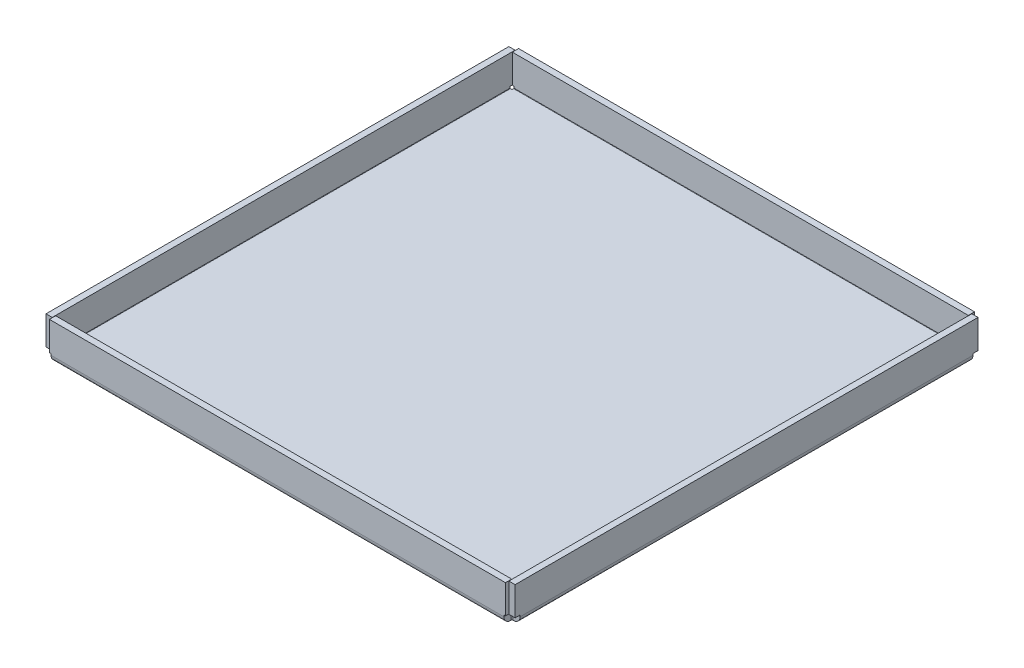
from build123d import *

# Parameters (mm, degrees)
SKETCH1_W                    = 736.6
SKETCH1_H                    = 736.6
BOSS_EXTRUDE1_DEPTH          = 50.8
SHELL1_T                     = -1.5875
CONVERT_SOLID1_START         = -368.3
CONVERT_SOLID1_DEPTH         = 4.587500016
CONVERT_SOLID1_START_2       = 363.712499984
CONVERT_SOLID1_2_DEPTH       = 4.587500016
CONVERT_SOLID1_START_3       = -363.712499984
CONVERT_SOLID1_3_DEPTH       = 727.424999968
CONVERT_SOLID1_START_4       = -376.7125
CONVERT_SOLID1_4_DEPTH       = 10.500000016
CONVERT_SOLID1_START_5       = 366.212499984
CONVERT_SOLID1_5_DEPTH       = 10.500000016
CONVERT_SOLID1_START_6       = -371.7125
CONVERT_SOLID1_6_OUTLINE_W   = 727.424999968
CONVERT_SOLID1_6_OUTLINE_H   = 8.4125
CONVERT_SOLID1_6_OUTLINE_W_2 = 10
CONVERT_SOLID1_6_OUTLINE_H_2 = 46.212499984
CONVERT_SOLID1_6_DEPTH       = 743.425
CONVERT_SOLID1_START_7       = -366.2125
CONVERT_SOLID1_7_DEPTH       = 732.425
CONVERT_SOLID1_START_8       = -366.7125
CONVERT_SOLID1_8_OUTLINE_W   = 49.2125
CONVERT_SOLID1_8_OUTLINE_H   = 1.5875
CONVERT_SOLID1_8_DEPTH       = 0.5
CONVERT_SOLID1_START_9       = 366.2125
CONVERT_SOLID1_9_OUTLINE_W   = 49.2125
CONVERT_SOLID1_9_OUTLINE_H   = 1.5875
CONVERT_SOLID1_9_DEPTH       = 0.5
CONVERT_SOLID1_10_OUTLINE_W  = 3.000000016
CONVERT_SOLID1_10_OUTLINE_H  = 1.5875
CONVERT_SOLID1_10_DEPTH      = 2.500000016
CONVERT_SOLID1_11_OUTLINE_W  = 3.000000016
CONVERT_SOLID1_11_OUTLINE_H  = 1.5875
CONVERT_SOLID1_11_DEPTH      = 2.500000016


with BuildPart() as part:
    # Sketch1 → Boss-Extrude1 (new body)
    with BuildSketch(Plane(origin=(0, 0, 0), x_dir=(1, 0, 0), z_dir=(0, 1, 0))):
        Rectangle(SKETCH1_W, SKETCH1_H)
    extrude(amount=BOSS_EXTRUDE1_DEPTH)

    # Shell1
    shell1_openings = [part.faces().sort_by_distance(p)[0] for p in [
        (0, 50.8, 0),
    ]]
    offset(amount=SHELL1_T, openings=shell1_openings, kind=Kind.INTERSECTION)

    # Convert-Solid1: read off the stored shape, not the designer's step
    # Convert-Solid1 outline → Convert-Solid1 (cut)
    with BuildSketch(Plane.XY.offset(CONVERT_SOLID1_START)):
        with BuildLine():
            Line((366.212499984, 1.5875), (363.712499984, 1.5875))
            Line((363.712499984, 1.5875), (363.712499984, 0))
            Line((363.712499984, 0), (368.3, 0))
            Line((368.3, 0), (368.3, 4.587500016))
            Line((368.3, 4.587500016), (366.7125, 4.587500016))
            Line((366.7125, 4.587500016), (366.7125, 2.087500016))
            ThreePointArc((366.7125, 2.087500016), (366.566053386, 1.733946614), (366.212499984, 1.5875))
        make_face()
        with BuildLine():
            Line((-363.712499984, 0), (-363.712499984, 1.5875))
            Line((-363.712499984, 1.5875), (-366.212499984, 1.5875))
            ThreePointArc((-366.212499984, 1.5875), (-366.566053386, 1.733946614), (-366.7125, 2.087500016))
            Line((-366.7125, 2.087500016), (-366.7125, 4.587500016))
            Line((-366.7125, 4.587500016), (-368.3, 4.587500016))
            Line((-368.3, 4.587500016), (-368.3, 0))
            Line((-368.3, 0), (-363.712499984, 0))
        make_face()
    extrude(amount=CONVERT_SOLID1_DEPTH, mode=Mode.SUBTRACT)

    # Convert-Solid1 2 outline → Convert-Solid1 2 (cut)
    with BuildSketch(Plane.XY.offset(CONVERT_SOLID1_START_2)):
        with BuildLine():
            Line((366.212499984, 1.5875), (363.712499984, 1.5875))
            Line((363.712499984, 1.5875), (363.712499984, 0))
            Line((363.712499984, 0), (368.3, 0))
            Line((368.3, 0), (368.3, 4.587500016))
            Line((368.3, 4.587500016), (366.7125, 4.587500016))
            Line((366.7125, 4.587500016), (366.7125, 2.087500016))
            ThreePointArc((366.7125, 2.087500016), (366.566053386, 1.733946614), (366.212499984, 1.5875))
        make_face()
        with BuildLine():
            Line((-363.712499984, 0), (-363.712499984, 1.5875))
            Line((-363.712499984, 1.5875), (-366.212499984, 1.5875))
            ThreePointArc((-366.212499984, 1.5875), (-366.566053386, 1.733946614), (-366.7125, 2.087500016))
            Line((-366.7125, 2.087500016), (-366.7125, 4.587500016))
            Line((-366.7125, 4.587500016), (-368.3, 4.587500016))
            Line((-368.3, 4.587500016), (-368.3, 0))
            Line((-368.3, 0), (-363.712499984, 0))
        make_face()
    extrude(amount=CONVERT_SOLID1_2_DEPTH, mode=Mode.SUBTRACT)

    # Convert-Solid1 3 outline → Convert-Solid1 3 (add)
    with BuildSketch(Plane.XY.offset(CONVERT_SOLID1_START_3)):
        with BuildLine():
            Line((368.3, 0), (-368.3, 0))
            Line((-368.3, 0), (-368.3, 50.8))
            Line((-368.3, 50.8), (-376.7125, 50.8))
            Line((-376.7125, 50.8), (-376.7125, 2.087500016))
            ThreePointArc((-376.7125, 2.087500016), (-373.637121198, -5.337121198), (-366.212499984, -8.4125))
            Line((-366.212499984, -8.4125), (366.212499984, -8.4125))
            ThreePointArc((366.212499984, -8.4125), (373.637121198, -5.337121198), (376.7125, 2.087500016))
            Line((376.7125, 2.087500016), (376.7125, 50.8))
            Line((376.7125, 50.8), (368.3, 50.8))
            Line((368.3, 50.8), (368.3, 0))
        make_face()
        with BuildLine():
            ThreePointArc((366.7125, 2.087500016), (366.566053386, 1.733946614), (366.212499984, 1.5875))
            Line((366.212499984, 1.5875), (366.7125, 1.5875))
            Line((366.7125, 1.5875), (366.7125, 2.087500016))
        make_face()
        with BuildLine():
            Line((-366.7125, 1.5875), (-366.212499984, 1.5875))
            ThreePointArc((-366.212499984, 1.5875), (-366.566053386, 1.733946614), (-366.7125, 2.087500016))
            Line((-366.7125, 2.087500016), (-366.7125, 1.5875))
        make_face()
    extrude(amount=CONVERT_SOLID1_3_DEPTH)

    # Convert-Solid1 4 outline → Convert-Solid1 4 (add)
    with BuildSketch(Plane.XY.offset(CONVERT_SOLID1_START_4)):
        Polygon((-363.712499984, -8.4125), (363.712499984, -8.4125), (363.712499984, 4.587500016), (366.2125, 4.587500016), (366.2125, 50.8), (-366.2125, 50.8), (-366.2125, 4.587500016), (-363.712499984, 4.587500016), align=None)
    extrude(amount=CONVERT_SOLID1_4_DEPTH)

    # Convert-Solid1 5 outline → Convert-Solid1 5 (add)
    with BuildSketch(Plane.XY.offset(CONVERT_SOLID1_START_5)):
        Polygon((-363.712499984, -8.4125), (363.712499984, -8.4125), (363.712499984, 4.587500016), (366.2125, 4.587500016), (366.2125, 50.8), (-366.2125, 50.8), (-366.2125, 4.587500016), (-363.712499984, 4.587500016), align=None)
    extrude(amount=CONVERT_SOLID1_5_DEPTH)

    # Convert-Solid1 6 outline → Convert-Solid1 6 (add)
    with BuildSketch(Plane.XY.offset(CONVERT_SOLID1_START_6)):
        with Locations((0, -4.20625)):
            Rectangle(CONVERT_SOLID1_6_OUTLINE_W, CONVERT_SOLID1_6_OUTLINE_H)
        with Locations((371.7125, 27.693750008)):
            Rectangle(CONVERT_SOLID1_6_OUTLINE_W_2, CONVERT_SOLID1_6_OUTLINE_H_2)
        with Locations((-371.7125, 27.693750008)):
            Rectangle(CONVERT_SOLID1_6_OUTLINE_W_2, CONVERT_SOLID1_6_OUTLINE_H_2)
    extrude(amount=CONVERT_SOLID1_6_DEPTH)

    # Convert-Solid1 7 outline → Convert-Solid1 7 (cut)
    with BuildSketch(Plane.YZ.offset(CONVERT_SOLID1_START_7)):
        with BuildLine():
            Line((50.8, -366.212499984), (1.5875, -366.212499984))
            ThreePointArc((1.5875, -366.212499984), (1.733946614, -366.566053386), (2.087500016, -366.7125))
            Line((2.087500016, -366.7125), (50.8, -366.7125))
            Line((50.8, -366.7125), (50.8, -366.212499984))
        make_face()
        with BuildLine():
            Line((50.8, 366.212499984), (50.8, 366.7125))
            Line((50.8, 366.7125), (2.087500016, 366.7125))
            ThreePointArc((2.087500016, 366.7125), (1.733946614, 366.566053386), (1.5875, 366.212499984))
            Line((1.5875, 366.212499984), (50.8, 366.212499984))
        make_face()
        with BuildLine():
            Line((-8.4125, -376.7125), (2.087500016, -376.7125))
            ThreePointArc((2.087500016, -376.7125), (-5.337121198, -373.637121198), (-8.4125, -366.212499984))
            Line((-8.4125, -366.212499984), (-8.4125, -376.7125))
        make_face()
        with BuildLine():
            Line((-8.4125, 376.7125), (-8.4125, 366.212499984))
            ThreePointArc((-8.4125, 366.212499984), (-5.337121198, 373.637121198), (2.087500016, 376.7125))
            Line((2.087500016, 376.7125), (-8.4125, 376.7125))
        make_face()
    extrude(amount=CONVERT_SOLID1_7_DEPTH, mode=Mode.SUBTRACT)

    # Convert-Solid1 8 outline → Convert-Solid1 8 (cut)
    with BuildSketch(Plane.YZ.offset(CONVERT_SOLID1_START_8)):
        with Locations((26.19375, -367.50625)):
            Rectangle(CONVERT_SOLID1_8_OUTLINE_W, CONVERT_SOLID1_8_OUTLINE_H)
        with Locations((26.19375, 367.50625)):
            Rectangle(CONVERT_SOLID1_8_OUTLINE_W, CONVERT_SOLID1_8_OUTLINE_H)
    extrude(amount=CONVERT_SOLID1_8_DEPTH, mode=Mode.SUBTRACT)

    # Convert-Solid1 9 outline → Convert-Solid1 9 (cut)
    with BuildSketch(Plane.YZ.offset(CONVERT_SOLID1_START_9)):
        with Locations((26.19375, -367.50625)):
            Rectangle(CONVERT_SOLID1_9_OUTLINE_W, CONVERT_SOLID1_9_OUTLINE_H)
        with Locations((26.19375, 367.50625)):
            Rectangle(CONVERT_SOLID1_9_OUTLINE_W, CONVERT_SOLID1_9_OUTLINE_H)
    extrude(amount=CONVERT_SOLID1_9_DEPTH, mode=Mode.SUBTRACT)

    # Convert-Solid1 10 outline → Convert-Solid1 10 (cut)
    with BuildSketch(Plane.YZ.offset(CONVERT_SOLID1_START_7)):
        with Locations((3.087500008, -367.50625)):
            Rectangle(CONVERT_SOLID1_10_OUTLINE_W, CONVERT_SOLID1_10_OUTLINE_H)
        with Locations((3.087500008, 367.50625)):
            Rectangle(CONVERT_SOLID1_10_OUTLINE_W, CONVERT_SOLID1_10_OUTLINE_H)
    extrude(amount=CONVERT_SOLID1_10_DEPTH, mode=Mode.SUBTRACT)

    # Convert-Solid1 11 outline → Convert-Solid1 11 (cut)
    with BuildSketch(Plane.YZ.offset(CONVERT_SOLID1_START_2)):
        with Locations((3.087500008, -367.50625)):
            Rectangle(CONVERT_SOLID1_11_OUTLINE_W, CONVERT_SOLID1_11_OUTLINE_H)
        with Locations((3.087500008, 367.50625)):
            Rectangle(CONVERT_SOLID1_11_OUTLINE_W, CONVERT_SOLID1_11_OUTLINE_H)
    extrude(amount=CONVERT_SOLID1_11_DEPTH, mode=Mode.SUBTRACT)


solid = part.part
